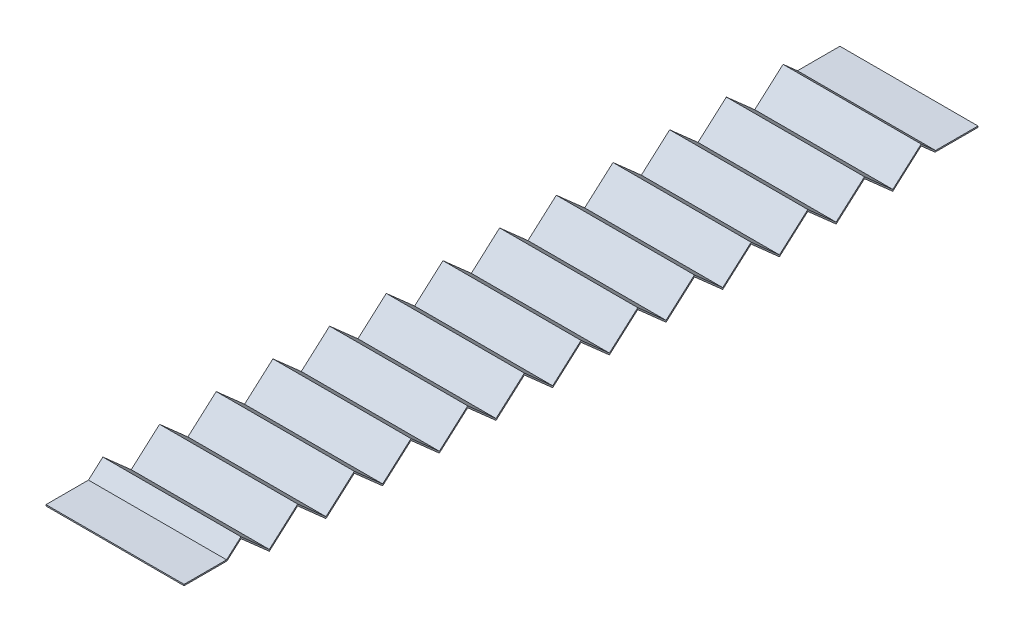
from build123d import *

# Parameters (mm, degrees)
EXTRUDE_THIN1_DEPTH = 27.5


with BuildPart() as part:
    # Sketch3 → Extrude-Thin1 (new, symmetric)
    with BuildSketch(Plane(origin=(0, 0, 0), x_dir=(0, 0, -1), z_dir=(1, 0, 0))):
        Polygon((0, 4.75), (17.094821022, 4.75), (22.643155114, 9.665985809), (33.929465342, -0.334014191), (45.21577557, 9.665985809), (56.502085798, -0.334014191), (67.788396026, 9.665985809), (79.074706254, -0.334014191), (90.361016482, 9.665985809), (101.64732671, -0.334014191), (112.933636939, 9.665985809), (124.219947167, -0.334014191), (135.506257395, 9.665985809), (146.792567623, -0.334014191), (158.078877851, 9.665985809), (169.365188079, -0.334014191), (180.651498307, 9.665985809), (191.937808535, -0.334014191), (203.224118763, 9.665985809), (214.510428991, -0.334014191), (225.796739219, 9.665985809), (237.083049447, -0.334014191), (248.369359675, 9.665985809), (259.655669903, -0.334014191), (270.941980131, 9.665985809), (282.228290359, -0.334014191), (293.514600587, 9.665985809), (299.062934679, 4.75), (316.157755702, 4.75), (316.157755702, 5.25), (299.252576724, 5.25), (293.514600587, 10.334014191), (282.228290359, 0.334014191), (270.941980131, 10.334014191), (259.655669903, 0.334014191), (248.369359675, 10.334014191), (237.083049447, 0.334014191), (225.796739219, 10.334014191), (214.510428991, 0.334014191), (203.224118763, 10.334014191), (191.937808535, 0.334014191), (180.651498307, 10.334014191), (169.365188079, 0.334014191), (158.078877851, 10.334014191), (146.792567623, 0.334014191), (135.506257395, 10.334014191), (124.219947167, 0.334014191), (112.933636939, 10.334014191), (101.64732671, 0.334014191), (90.361016482, 10.334014191), (79.074706254, 0.334014191), (67.788396026, 10.334014191), (56.502085798, 0.334014191), (45.21577557, 10.334014191), (33.929465342, 0.334014191), (22.643155114, 10.334014191), (16.905178978, 5.25), (0, 5.25), align=None)
    extrude(amount=EXTRUDE_THIN1_DEPTH, both=True)


solid = part.part
